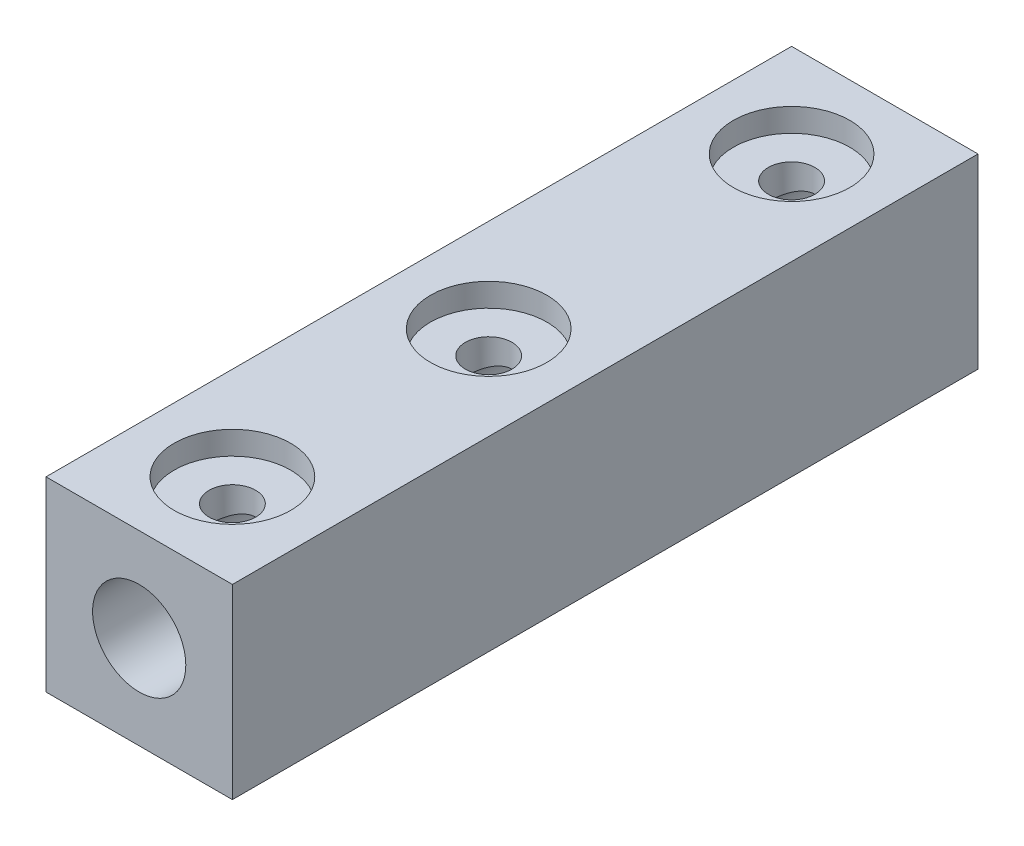
from build123d import *

# Parameters (mm, degrees)
SKETCH18_W                 = 25.4
SKETCH18_H                 = 25.4
BOSS_EXTRUDE3_DEPTH        = 50.8
F_1_2_0_5_DIAMETER_HOLE2_D = 12.7
SKETCH26_R                 = 3.175
CUT_EXTRUDE10_DEPTH        = 12.7
SKETCH27_R                 = 7.9375
CUT_EXTRUDE11_DEPTH        = 3.175
CUT_EXTRUDE12_START        = -12.7
SKETCH28_R                 = 3.175
CUT_EXTRUDE12_DEPTH        = 12.7
CUT_EXTRUDE13_START        = -3.175
SKETCH29_R                 = 7.9375
CUT_EXTRUDE13_DEPTH        = 3.175


with BuildPart() as part:
    # Sketch18 → Boss-Extrude3 (new, symmetric)
    with BuildSketch(Plane.XY):
        Rectangle(SKETCH18_W, SKETCH18_H)
    extrude(amount=BOSS_EXTRUDE3_DEPTH, both=True)

    # 1/2 (0.5) Diameter Hole2 (through all)
    with Locations(Plane.XY.offset(50.8)):
        with Locations((0, 0)):
            Hole(F_1_2_0_5_DIAMETER_HOLE2_D / 2)

    # Sketch26 → Cut-Extrude10 (cut)
    with BuildSketch(Plane(origin=(0, 12.7, 0), x_dir=(1, 0, 0), z_dir=(0, 1, 0))):
        with Locations((0, -38.1)):
            Circle(SKETCH26_R)
        with Locations((0, -3.175)):
            Circle(SKETCH26_R)
        with Locations((0, 38.1)):
            Circle(SKETCH26_R)
    extrude(amount=-CUT_EXTRUDE10_DEPTH, mode=Mode.SUBTRACT)

    # Sketch27 → Cut-Extrude11 (cut)
    with BuildSketch(Plane(origin=(0, 12.7, 0), x_dir=(1, 0, 0), z_dir=(0, 1, 0))):
        with Locations((0, 38.1)):
            Circle(SKETCH27_R)
        with Locations((0, -3.175)):
            Circle(SKETCH27_R)
        with Locations((0, -38.1)):
            Circle(SKETCH27_R)
    extrude(amount=-CUT_EXTRUDE11_DEPTH, mode=Mode.SUBTRACT)

    # Sketch28 → Cut-Extrude12 (cut)
    with BuildSketch(Plane.XZ.offset(12.7).offset(CUT_EXTRUDE12_START)):
        with Locations((0, 3.175)):
            Circle(SKETCH28_R)
    extrude(amount=CUT_EXTRUDE12_DEPTH, mode=Mode.SUBTRACT)

    # Sketch29 → Cut-Extrude13 (cut)
    with BuildSketch(Plane(origin=(0, -12.7, 0), x_dir=(-1, 0, 0), z_dir=(0, -1, 0)).offset(CUT_EXTRUDE13_START)):
        with Locations((0, -3.175)):
            Circle(SKETCH29_R)
    extrude(amount=CUT_EXTRUDE13_DEPTH, mode=Mode.SUBTRACT)


solid = part.part
